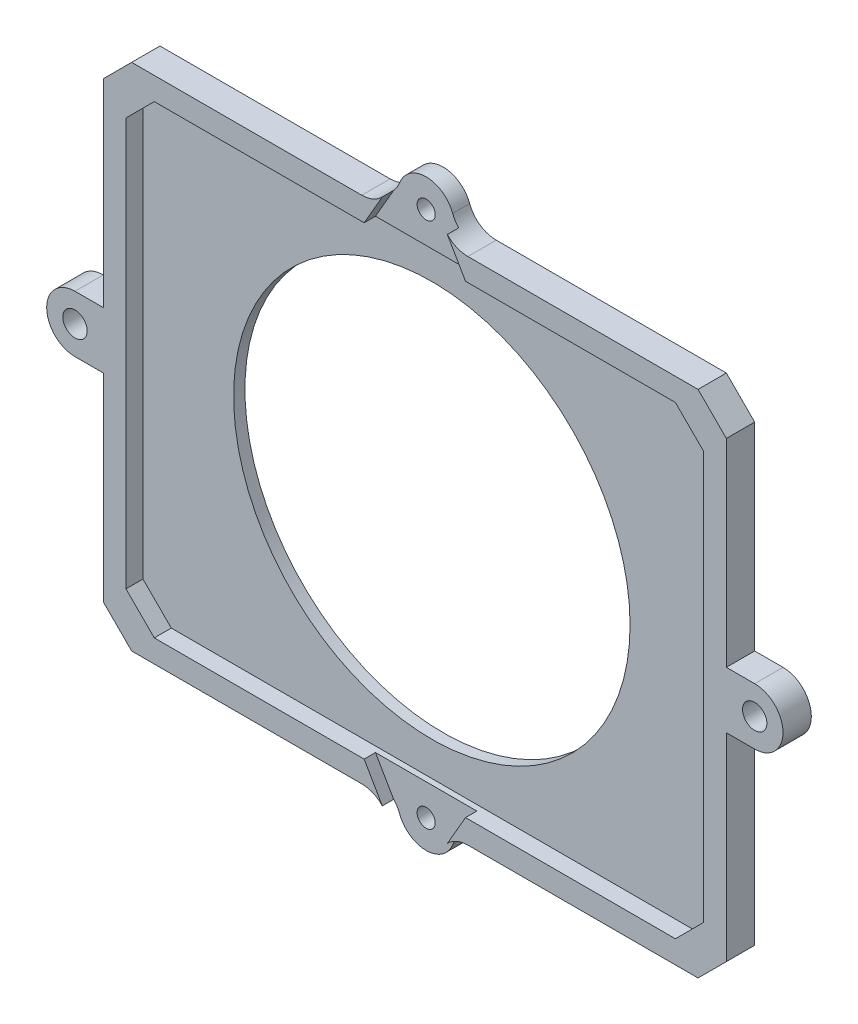
from build123d import *

# Parameters (mm, degrees)
SKETCH_1_W          = 102
SKETCH_1_H          = 82
SKETCH_1_R          = 35
EXTRUDE_1_DEPTH     = 2
SKETCH_2_W          = 110
SKETCH_2_H          = 90
SKETCH_2_W_2        = 102
SKETCH_2_H_2        = 82
EXTRUDE_2_DEPTH     = 5
EXTRUDE_3_DEPTH     = 3
CUT_EXTRUDE_1_DEPTH = 140.306317158
FILLET_1_R          = 5
SKETCH_5_R          = 2.15
EXTRUDE_4_DEPTH     = 5
CHAMFER_1_SIZE      = 5
SKETCH_6_R          = 1.6
CUT_EXTRUDE_2_DEPTH = 147.990645961


with BuildPart() as part:
    # 草图1 → 凸台-拉伸1 (new body)
    with BuildSketch(Plane.XY):
        with Locations((50, 40)):
            Rectangle(SKETCH_1_W, SKETCH_1_H)
        with Locations((50, 40)):
            Circle(SKETCH_1_R, mode=Mode.SUBTRACT)
    extrude(amount=EXTRUDE_1_DEPTH)

    # 草图2 → 凸台-拉伸2 (add)
    with BuildSketch(Plane(origin=(0, 0, 0), x_dir=(-1, 0, 0), z_dir=(0, 0, -1))):
        with Locations((-50, 40)):
            Rectangle(SKETCH_2_W, SKETCH_2_H)
        with Locations((-50, 40)):
            Rectangle(SKETCH_2_W_2, SKETCH_2_H_2, mode=Mode.SUBTRACT)
    extrude(amount=-EXTRUDE_2_DEPTH)

    # 草图3 → 凸台-拉伸3 (add)
    with BuildSketch(Plane(origin=(0, 0, 0), x_dir=(-1, 0, 0), z_dir=(0, 0, -1))):
        with BuildLine():
            Line((-55, 86.5), (-55, 85))
            Line((-55, 85), (-50.556776436, 85))
            ThreePointArc((-50.556776436, 85), (-50, 88.1), (-49.443223564, 85))
            Line((-49.443223564, 85), (-45, 85))
            Line((-45, 85), (-45, 86.5))
            ThreePointArc((-45, 86.5), (-50, 91.5), (-55, 86.5))
        make_face()
        with BuildLine():
            Line((-55, -6.5), (-55, -5))
            Line((-55, -5), (-50.556776436, -5))
            ThreePointArc((-50.556776436, -5), (-50, -8.1), (-49.443223564, -5))
            Line((-49.443223564, -5), (-45, -5))
            Line((-45, -5), (-45, -6.5))
            ThreePointArc((-45, -6.5), (-50, -11.5), (-55, -6.5))
        make_face()
    extrude(amount=-EXTRUDE_3_DEPTH)

    # 草图4 → 切除-拉伸1 (cut, through all)
    with BuildSketch(Plane.XY.offset(3)):
        with BuildLine():
            Line((45.669872981, 89), (41.051070828, 81))
            Line((41.051070828, 81), (58.948929172, 81))
            Line((58.948929172, 81), (54.330127019, 89))
            ThreePointArc((54.330127019, 89), (50, 91.5), (45.669872981, 89))
        make_face()
        with BuildLine():
            Line((58.948929172, -1), (54.330127019, -9))
            ThreePointArc((54.330127019, -9), (50, -11.5), (45.669872981, -9))
            Line((45.669872981, -9), (41.051070828, -1))
            Line((41.051070828, -1), (58.948929172, -1))
        make_face()
    extrude(amount=CUT_EXTRUDE_1_DEPTH, mode=Mode.SUBTRACT)

    # 圆角1
    # the kernel refuses this fillet: 5 mm, written as the material it adds along each edge
    with BuildSketch(Plane(origin=(55, -5, 0), x_dir=(-0.09685070087569839, -0.995298920797107, 0), z_dir=(0, 0, 1))) as fillet_1_piece_1_section:
        with BuildLine():
            CenterArc((4.553499459, 4.831218553), FILLET_1_R, 185.557848431, 69.512684885)
            Line((-0.422995145, 4.346965048), (-0.920644606, 4.298539698))
            Line((-0.920644606, 4.298539698), (-0.49764946, -0.04842535))
            Line((-0.49764946, -0.04842535), (0.04842535, -0.49764946))
            ThreePointArc((0.04842535, -0.49764946), (1.541373732, -0.352373409), (3.136535793, -0.483121855))
            Line((3.136535793, -0.483121855), (3.265350672, 0))
        make_face()
    fillet_1_piece_1 = extrude(amount=3, mode=Mode.PRIVATE)
    fillet_1_piece_1 = split(fillet_1_piece_1, bisect_by=Plane(origin=(55.914654271, -6.255518293, 1.5), z_dir=(-0.8660254037844367, 0.5000000000000034, 0)), keep=Keep.TOP, mode=Mode.PRIVATE)
    add(fillet_1_piece_1)
    with BuildSketch(Plane(origin=(55, -5, 0), x_dir=(-0.09685070087569839, -0.995298920797107, 0), z_dir=(0, 0, 1))) as fillet_1_piece_2_section:
        with BuildLine():
            CenterArc((4.553499459, 4.831218553), FILLET_1_R, 185.557848431, 69.512684885)
            Line((-0.422995145, 4.346965048), (-0.920644606, 4.298539698))
            Line((-0.920644606, 4.298539698), (-0.49764946, -0.04842535))
            Line((-0.49764946, -0.04842535), (0.04842535, -0.49764946))
            ThreePointArc((0.04842535, -0.49764946), (1.541373732, -0.352373409), (3.136535793, -0.483121855))
            Line((3.136535793, -0.483121855), (3.265350672, 0))
        make_face()
    fillet_1_piece_2 = extrude(amount=3, mode=Mode.PRIVATE)
    fillet_1_piece_2 = split(fillet_1_piece_2, bisect_by=Plane(origin=(56.857806143, -4.621931332, 1.5), z_dir=(0.8660254037844367, -0.5000000000000034, 0)), keep=Keep.TOP, mode=Mode.PRIVATE)
    add(fillet_1_piece_2)
    with BuildSketch(Plane(origin=(55, -5, 0), x_dir=(-0.09685070087569839, -0.995298920797107, 0), z_dir=(0, 0, 1))) as fillet_1_piece_3_section:
        with BuildLine():
            CenterArc((4.553499459, 4.831218553), FILLET_1_R, 185.557848431, 69.512684885)
            Line((-0.422995145, 4.346965048), (-0.920644606, 4.298539698))
            Line((-0.920644606, 4.298539698), (-0.49764946, -0.04842535))
            Line((-0.49764946, -0.04842535), (0.04842535, -0.49764946))
            ThreePointArc((0.04842535, -0.49764946), (1.541373732, -0.352373409), (3.136535793, -0.483121855))
            Line((3.136535793, -0.483121855), (3.265350672, 0))
        make_face()
    fillet_1_piece_3 = extrude(amount=13.918742494, mode=Mode.PRIVATE)
    fillet_1_piece_3 = split(fillet_1_piece_3, bisect_by=Plane(origin=(57.593647947, -5.046769796, 5), z_dir=(0, 0, -1)), keep=Keep.TOP, mode=Mode.PRIVATE)
    fillet_1_piece_3 = split(fillet_1_piece_3, bisect_by=Plane(origin=(56.857806143, -4.621931332, 4), z_dir=(0.8660254037844367, -0.5000000000000034, 0)), keep=Keep.TOP, mode=Mode.PRIVATE)
    fillet_1_piece_3 = split(fillet_1_piece_3, bisect_by=Plane(origin=(57.593647947, -5.046769796, 3), z_dir=(0, 0, 1)), keep=Keep.TOP, mode=Mode.PRIVATE)
    add(fillet_1_piece_3)
    with BuildSketch(Plane(origin=(45, -5, 0), x_dir=(0.09685070087569624, -0.9952989207971072, 0), z_dir=(0, 0, 1))) as fillet_1_piece_4_section:
        with BuildLine():
            CenterArc((4.553499459, -4.831218553), FILLET_1_R, 104.929466684, 69.512684885)
            Line((-0.422995145, -4.346965048), (-0.920644606, -4.298539698))
            Line((-0.920644606, -4.298539698), (-0.49764946, 0.04842535))
            Line((-0.49764946, 0.04842535), (0.04842535, 0.49764946))
            ThreePointArc((0.04842535, 0.49764946), (1.541373732, 0.352373409), (3.136535793, 0.483121855))
            Line((3.136535793, 0.483121855), (3.265350672, 0))
        make_face()
    fillet_1_piece_4 = extrude(amount=3, mode=Mode.PRIVATE)
    fillet_1_piece_4 = split(fillet_1_piece_4, bisect_by=Plane(origin=(44.085345729, -6.255518293, 1.5), z_dir=(0.8660254037844364, 0.5000000000000041, 0)), keep=Keep.TOP, mode=Mode.PRIVATE)
    add(fillet_1_piece_4)
    with BuildSketch(Plane(origin=(45, -5, 0), x_dir=(0.09685070087569624, -0.9952989207971072, 0), z_dir=(0, 0, 1))) as fillet_1_piece_5_section:
        with BuildLine():
            CenterArc((4.553499459, -4.831218553), FILLET_1_R, 104.929466684, 69.512684885)
            Line((-0.422995145, -4.346965048), (-0.920644606, -4.298539698))
            Line((-0.920644606, -4.298539698), (-0.49764946, 0.04842535))
            Line((-0.49764946, 0.04842535), (0.04842535, 0.49764946))
            ThreePointArc((0.04842535, 0.49764946), (1.541373732, 0.352373409), (3.136535793, 0.483121855))
            Line((3.136535793, 0.483121855), (3.265350672, 0))
        make_face()
    fillet_1_piece_5 = extrude(amount=3, mode=Mode.PRIVATE)
    fillet_1_piece_5 = split(fillet_1_piece_5, bisect_by=Plane(origin=(43.142193857, -4.621931332, 1.5), z_dir=(-0.8660254037844364, -0.5000000000000041, 0)), keep=Keep.TOP, mode=Mode.PRIVATE)
    add(fillet_1_piece_5)
    with BuildSketch(Plane(origin=(45, -5, 0), x_dir=(0.09685070087569624, -0.9952989207971072, 0), z_dir=(0, 0, 1))) as fillet_1_piece_6_section:
        with BuildLine():
            CenterArc((4.553499459, -4.831218553), FILLET_1_R, 104.929466684, 69.512684885)
            Line((-0.422995145, -4.346965048), (-0.920644606, -4.298539698))
            Line((-0.920644606, -4.298539698), (-0.49764946, 0.04842535))
            Line((-0.49764946, 0.04842535), (0.04842535, 0.49764946))
            ThreePointArc((0.04842535, 0.49764946), (1.541373732, 0.352373409), (3.136535793, 0.483121855))
            Line((3.136535793, 0.483121855), (3.265350672, 0))
        make_face()
    fillet_1_piece_6 = extrude(amount=13.918742494, mode=Mode.PRIVATE)
    fillet_1_piece_6 = split(fillet_1_piece_6, bisect_by=Plane(origin=(42.406352053, -5.046769796, 5), z_dir=(0, 0, -1)), keep=Keep.TOP, mode=Mode.PRIVATE)
    fillet_1_piece_6 = split(fillet_1_piece_6, bisect_by=Plane(origin=(42.406352053, -5.046769796, 3), z_dir=(0, 0, 1)), keep=Keep.TOP, mode=Mode.PRIVATE)
    fillet_1_piece_6 = split(fillet_1_piece_6, bisect_by=Plane(origin=(43.142193857, -4.621931332, 4), z_dir=(-0.8660254037844364, -0.5000000000000041, 0)), keep=Keep.TOP, mode=Mode.PRIVATE)
    add(fillet_1_piece_6)
    with BuildSketch(Plane(origin=(55, 85, 0), x_dir=(-0.0968507008756942, 0.9952989207971075, 0), z_dir=(0, 0, 1))) as fillet_1_piece_7_section:
        with BuildLine():
            CenterArc((4.553499459, -4.831218553), FILLET_1_R, 104.929466684, 69.512684885)
            Line((-0.422995145, -4.346965048), (-0.920644606, -4.298539698))
            Line((-0.920644606, -4.298539698), (-0.49764946, 0.04842535))
            Line((-0.49764946, 0.04842535), (0.04842535, 0.49764946))
            ThreePointArc((0.04842535, 0.49764946), (1.541373732, 0.352373409), (3.136535793, 0.483121855))
            Line((3.136535793, 0.483121855), (3.265350672, 0))
        make_face()
    fillet_1_piece_7 = extrude(amount=3, mode=Mode.PRIVATE)
    fillet_1_piece_7 = split(fillet_1_piece_7, bisect_by=Plane(origin=(55.914654271, 86.255518293, 1.5), z_dir=(-0.8660254037844369, -0.5000000000000031, 0)), keep=Keep.TOP, mode=Mode.PRIVATE)
    add(fillet_1_piece_7)
    with BuildSketch(Plane(origin=(55, 85, 0), x_dir=(-0.0968507008756942, 0.9952989207971075, 0), z_dir=(0, 0, 1))) as fillet_1_piece_8_section:
        with BuildLine():
            CenterArc((4.553499459, -4.831218553), FILLET_1_R, 104.929466684, 69.512684885)
            Line((-0.422995145, -4.346965048), (-0.920644606, -4.298539698))
            Line((-0.920644606, -4.298539698), (-0.49764946, 0.04842535))
            Line((-0.49764946, 0.04842535), (0.04842535, 0.49764946))
            ThreePointArc((0.04842535, 0.49764946), (1.541373732, 0.352373409), (3.136535793, 0.483121855))
            Line((3.136535793, 0.483121855), (3.265350672, 0))
        make_face()
    fillet_1_piece_8 = extrude(amount=3, mode=Mode.PRIVATE)
    fillet_1_piece_8 = split(fillet_1_piece_8, bisect_by=Plane(origin=(56.857806143, 84.621931332, 1.5), z_dir=(0.8660254037844369, 0.5000000000000031, 0)), keep=Keep.TOP, mode=Mode.PRIVATE)
    add(fillet_1_piece_8)
    with BuildSketch(Plane(origin=(55, 85, 0), x_dir=(-0.0968507008756942, 0.9952989207971075, 0), z_dir=(0, 0, 1))) as fillet_1_piece_9_section:
        with BuildLine():
            CenterArc((4.553499459, -4.831218553), FILLET_1_R, 104.929466684, 69.512684885)
            Line((-0.422995145, -4.346965048), (-0.920644606, -4.298539698))
            Line((-0.920644606, -4.298539698), (-0.49764946, 0.04842535))
            Line((-0.49764946, 0.04842535), (0.04842535, 0.49764946))
            ThreePointArc((0.04842535, 0.49764946), (1.541373732, 0.352373409), (3.136535793, 0.483121855))
            Line((3.136535793, 0.483121855), (3.265350672, 0))
        make_face()
    fillet_1_piece_9 = extrude(amount=13.918742494, mode=Mode.PRIVATE)
    fillet_1_piece_9 = split(fillet_1_piece_9, bisect_by=Plane(origin=(57.593647947, 85.046769796, 3), z_dir=(0, 0, 1)), keep=Keep.TOP, mode=Mode.PRIVATE)
    fillet_1_piece_9 = split(fillet_1_piece_9, bisect_by=Plane(origin=(56.857806143, 84.621931332, 4), z_dir=(0.8660254037844369, 0.5000000000000031, 0)), keep=Keep.TOP, mode=Mode.PRIVATE)
    fillet_1_piece_9 = split(fillet_1_piece_9, bisect_by=Plane(origin=(57.593647947, 85.046769796, 5), z_dir=(0, 0, -1)), keep=Keep.TOP, mode=Mode.PRIVATE)
    add(fillet_1_piece_9)
    with BuildSketch(Plane(origin=(45, 85, 0), x_dir=(-1, 0, 0), z_dir=(0, 0, 1))) as fillet_1_piece_10_section:
        with BuildLine():
            CenterArc((4.367496998, -5), FILLET_1_R, 90, 69.512684885)
            Line((-0.316251501, -3.25), (-0.784626351, -3.075))
            ThreePointArc((-0.784626351, -3.075), (-0.5, -1.5), (-0.5, 0))
            Line((-0.5, 0), (0, 0.5))
            Line((0, 0.5), (4.367496998, 0.5))
            Line((4.367496998, 0.5), (4.367496998, 0))
        make_face()
    fillet_1_piece_10 = extrude(amount=3, mode=Mode.PRIVATE)
    fillet_1_piece_10 = split(fillet_1_piece_10, bisect_by=Plane(origin=(43.142193857, 84.621931332, 1.5), z_dir=(-0.8660254037844366, 0.5000000000000037, 0)), keep=Keep.TOP, mode=Mode.PRIVATE)
    add(fillet_1_piece_10)
    with BuildSketch(Plane(origin=(45, 85, 0), x_dir=(-1, 0, 0), z_dir=(0, 0, 1))) as fillet_1_piece_11_section:
        with BuildLine():
            CenterArc((4.367496998, -5), FILLET_1_R, 90, 69.512684885)
            Line((-0.316251501, -3.25), (-0.784626351, -3.075))
            ThreePointArc((-0.784626351, -3.075), (-0.5, -1.5), (-0.5, 0))
            Line((-0.5, 0), (0, 0.5))
            Line((0, 0.5), (4.367496998, 0.5))
            Line((4.367496998, 0.5), (4.367496998, 0))
        make_face()
    fillet_1_piece_11 = extrude(amount=3, mode=Mode.PRIVATE)
    fillet_1_piece_11 = split(fillet_1_piece_11, bisect_by=Plane(origin=(44.085345729, 86.255518293, 1.5), z_dir=(0.8660254037844366, -0.5000000000000037, 0)), keep=Keep.TOP, mode=Mode.PRIVATE)
    add(fillet_1_piece_11)
    with BuildSketch(Plane(origin=(45, 85, 0), x_dir=(-1, 0, 0), z_dir=(0, 0, 1))) as fillet_1_piece_12_section:
        with BuildLine():
            CenterArc((4.367496998, -5), FILLET_1_R, 90, 69.512684885)
            Line((-0.316251501, -3.25), (-0.784626351, -3.075))
            ThreePointArc((-0.784626351, -3.075), (-0.5, -1.5), (-0.5, 0))
            Line((-0.5, 0), (0, 0.5))
            Line((0, 0.5), (4.367496998, 0.5))
            Line((4.367496998, 0.5), (4.367496998, 0))
        make_face()
    fillet_1_piece_12 = extrude(amount=13.918742494, mode=Mode.PRIVATE)
    fillet_1_piece_12 = split(fillet_1_piece_12, bisect_by=Plane(origin=(42.406352053, 85.046769796, 5), z_dir=(0, 0, -1)), keep=Keep.TOP, mode=Mode.PRIVATE)
    fillet_1_piece_12 = split(fillet_1_piece_12, bisect_by=Plane(origin=(42.406352053, 85.046769796, 3), z_dir=(0, 0, 1)), keep=Keep.TOP, mode=Mode.PRIVATE)
    fillet_1_piece_12 = split(fillet_1_piece_12, bisect_by=Plane(origin=(43.142193857, 84.621931332, 4), z_dir=(-0.8660254037844366, 0.5000000000000037, 0)), keep=Keep.TOP, mode=Mode.PRIVATE)
    add(fillet_1_piece_12)

    # 草图5 → 凸台-拉伸4 (add)
    # profile 1 of 2: a face of its own
    with BuildSketch(Plane.XY.offset(5)):
        with BuildLine():
            Line((-10, 45), (-5, 45))
            Line((-5, 45), (-5, 35))
            Line((-5, 35), (-10, 35))
            ThreePointArc((-10, 35), (-15, 40), (-10, 45))
        make_face()
        with Locations((-10, 40)):
            Circle(SKETCH_5_R, mode=Mode.SUBTRACT)
    # profile 2 of 2: a face of its own
    with BuildSketch(Plane.XY.offset(5)):
        with BuildLine():
            Line((105, 35), (110, 35))
            ThreePointArc((110, 35), (115, 40), (110, 45))
            Line((110, 45), (105, 45))
            Line((105, 45), (105, 35))
        make_face()
        with Locations(Location((110, 40, 0), (0, 0, 180))):
            Circle(SKETCH_5_R, mode=Mode.SUBTRACT)
    extrude(amount=-EXTRUDE_4_DEPTH)

    # 倒角1
    chamfer_1_edges = [part.edges().sort_by_distance(p)[0] for p in [
        (101, -1, 3.5),
        (-1, 81, 3.5),
        (101, 81, 3.5),
        (-1, -1, 3.5),
        (-5, -5, 2.5),
        (105, -5, 2.5),
        (105, 85, 2.5),
        (-5, 85, 2.5),
    ]]
    chamfer(chamfer_1_edges, length=CHAMFER_1_SIZE)

    # 草图6 → 切除-拉伸2 (cut, through all)
    with BuildSketch(Plane.XY.offset(3)):
        with Locations(Location((50, 86.5, 0), (0, 0, 180))):
            Circle(SKETCH_6_R)
        with Locations(Location((50, -6.5, 0), (0, 0, 180))):
            Circle(SKETCH_6_R)
    extrude(amount=-CUT_EXTRUDE_2_DEPTH, mode=Mode.SUBTRACT)


solid = part.part
